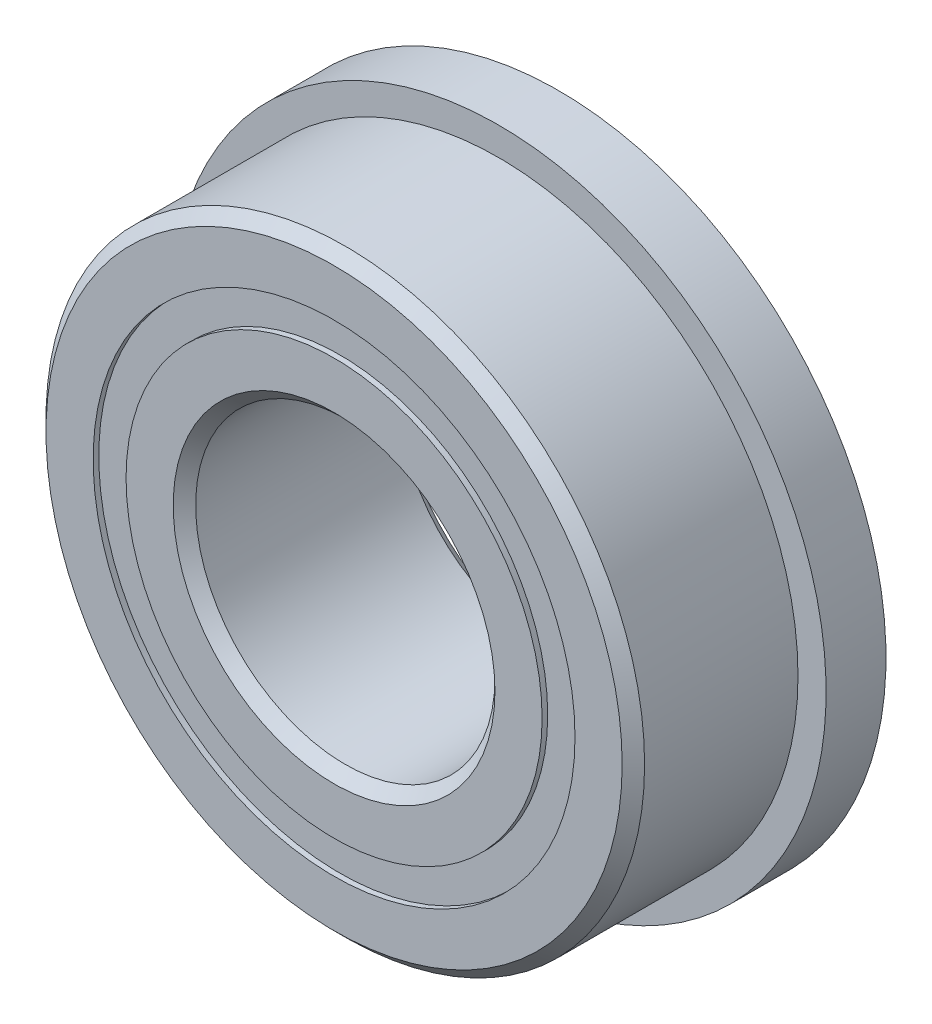
from build123d import *

# Parameters (mm, degrees)
CIRPATTERN1_COUNT = 12
SKETCH5_W         = 1.147826059
SKETCH5_H         = 0.697802198
SKETCH6_W         = 1.27
SKETCH6_H         = 1.835498901


with BuildPart() as part:
    # Sketch1 → Revolve1 (revolve)
    with BuildSketch(Plane(origin=(0, 0, 0), x_dir=(0, 0, -1), z_dir=(1, 0, 0))):
        with BuildLine():
            Line((2.143125, 6.35), (-2.143125, 6.35))
            Line((-2.143125, 6.35), (-2.38125, 6.111875))
            Line((-2.38125, 6.111875), (-2.38125, 5.111401099))
            Line((-2.38125, 5.111401099), (-1.058333333, 5.111401099))
            ThreePointArc((-1.058333333, 5.111401099), (0, 5.876861441), (1.058333333, 5.111401099))
            Line((1.058333333, 5.111401099), (2.38125, 5.111401099))
            Line((2.38125, 5.111401099), (2.38125, 6.111875))
            Line((2.38125, 6.111875), (2.143125, 6.35))
        make_face()
    revolve(axis=Axis((0, 0, 2.38125), (0, 0, -1)))

    # Sketch6 → Revolve6 (revolve)
    with BuildSketch(Plane(origin=(0, 0, 0), x_dir=(0, 0, -1), z_dir=(1, 0, 0))):
        with Locations((1.74625, 6.02915055)):
            Rectangle(SKETCH6_W, SKETCH6_H)
    revolve(axis=Axis((0, 0, -2.38125), (0, 0, 1)))


with BuildPart() as body_2:
    # Sketch3 → Revolve3 (revolve)
    with BuildSketch(Plane(origin=(0, 0, 0), x_dir=(0, 0, -1), z_dir=(1, 0, 0))):
        with BuildLine():
            Line((-2.38125, 4.413598901), (-1.058333333, 4.413598901))
            ThreePointArc((-1.058333333, 4.413598901), (0, 3.648138559), (1.058333333, 4.413598901))
            Line((1.058333333, 4.413598901), (2.38125, 4.413598901))
            Line((2.38125, 4.413598901), (2.38125, 3.413125))
            Line((2.38125, 3.413125), (2.143125, 3.175))
            Line((2.143125, 3.175), (-2.143125, 3.175))
            Line((-2.143125, 3.175), (-2.38125, 3.413125))
            Line((-2.38125, 3.413125), (-2.38125, 4.413598901))
        make_face()
    revolve(axis=Axis((0, 0, 2.38125), (0, 0, -1)))


with BuildPart() as body_3:
    # Sketch4 → Revolve4 (revolve)
    with BuildSketch(Plane(origin=(0, 0, 0), x_dir=(0, 0, -1), z_dir=(1, 0, 0))):
        with BuildLine():
            Line((-1.114361441, 4.7625), (1.114361441, 4.7625))
            ThreePointArc((1.114361441, 4.7625), (0, 5.876861441), (-1.114361441, 4.7625))
        make_face()
    revolve(axis=Axis((0, 4.7625, 1.114361441), (0, 0, -1)))


with BuildPart() as cirpattern1_1:
    # CirPattern1: pattern copy
    add(body_3.part.rotate(Axis((0, 0, -2.38125), (0, 0, 1)), 1 * 360 / CIRPATTERN1_COUNT))


with BuildPart() as cirpattern1_2:
    # CirPattern1: pattern copy
    add(body_3.part.rotate(Axis((0, 0, -2.38125), (0, 0, 1)), 2 * 360 / CIRPATTERN1_COUNT))


with BuildPart() as cirpattern1_3:
    # CirPattern1: pattern copy
    add(body_3.part.rotate(Axis((0, 0, -2.38125), (0, 0, 1)), 3 * 360 / CIRPATTERN1_COUNT))


with BuildPart() as cirpattern1_4:
    # CirPattern1: pattern copy
    add(body_3.part.rotate(Axis((0, 0, -2.38125), (0, 0, 1)), 4 * 360 / CIRPATTERN1_COUNT))


with BuildPart() as cirpattern1_5:
    # CirPattern1: pattern copy
    add(body_3.part.rotate(Axis((0, 0, -2.38125), (0, 0, 1)), 5 * 360 / CIRPATTERN1_COUNT))


with BuildPart() as cirpattern1_6:
    # CirPattern1: pattern copy
    add(body_3.part.rotate(Axis((0, 0, -2.38125), (0, 0, 1)), 6 * 360 / CIRPATTERN1_COUNT))


with BuildPart() as cirpattern1_7:
    # CirPattern1: pattern copy
    add(body_3.part.rotate(Axis((0, 0, -2.38125), (0, 0, 1)), 7 * 360 / CIRPATTERN1_COUNT))


with BuildPart() as cirpattern1_8:
    # CirPattern1: pattern copy
    add(body_3.part.rotate(Axis((0, 0, -2.38125), (0, 0, 1)), 8 * 360 / CIRPATTERN1_COUNT))


with BuildPart() as cirpattern1_9:
    # CirPattern1: pattern copy
    add(body_3.part.rotate(Axis((0, 0, -2.38125), (0, 0, 1)), 9 * 360 / CIRPATTERN1_COUNT))


with BuildPart() as cirpattern1_10:
    # CirPattern1: pattern copy
    add(body_3.part.rotate(Axis((0, 0, -2.38125), (0, 0, 1)), 10 * 360 / CIRPATTERN1_COUNT))


with BuildPart() as cirpattern1_11:
    # CirPattern1: pattern copy
    add(body_3.part.rotate(Axis((0, 0, -2.38125), (0, 0, 1)), 11 * 360 / CIRPATTERN1_COUNT))


with BuildPart() as body_15:
    # Sketch5 → Revolve5 (revolve)
    with BuildSketch(Plane(origin=(0, 0, 0), x_dir=(0, 0, -1), z_dir=(1, 0, 0))):
        with Locations((-1.688274471, 4.7625)):
            Rectangle(SKETCH5_W, SKETCH5_H)
        with Locations((1.688274471, 4.7625)):
            Rectangle(SKETCH5_W, SKETCH5_H)
    revolve(axis=Axis((0, 0, 2.38125), (0, 0, -1)))


solid = Compound([part.part, body_2.part, body_3.part, cirpattern1_1.part, cirpattern1_2.part, cirpattern1_3.part, cirpattern1_4.part, cirpattern1_5.part, cirpattern1_6.part, cirpattern1_7.part, cirpattern1_8.part, cirpattern1_9.part, cirpattern1_10.part, cirpattern1_11.part, body_15.part])
